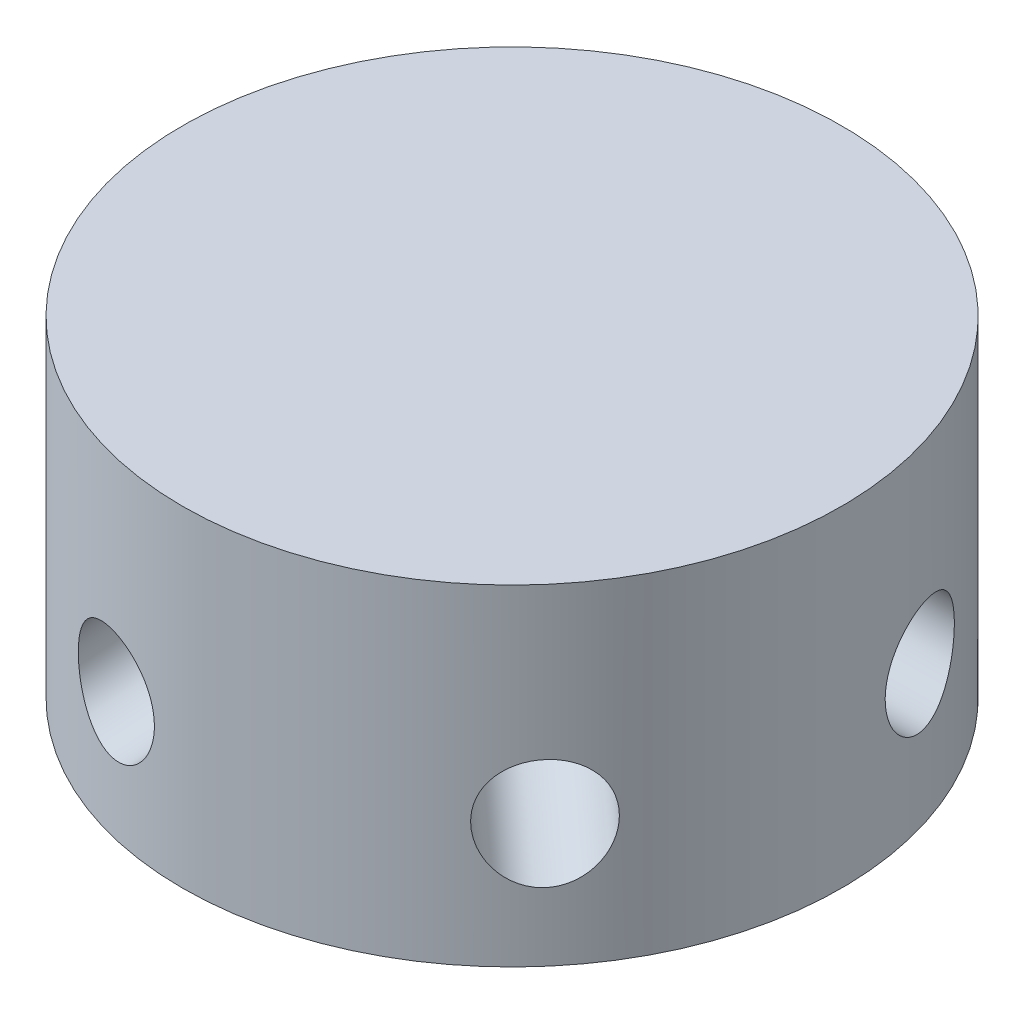
from build123d import *

# Parameters (mm, degrees)
BASE_DEPTH          = 3.035432218
BASE_DEPTH_BACK     = 7
SKETCH1_R           = 10
SKETCH3_R           = 1.6
HOLE2_DEPTH         = 19.445737436
HOLE2MIRROR_COUNT   = 2
SKETCH4_R           = 1.6
HOLE3_DEPTH         = 19.389503466
SKETCH5_R           = 1.6
CUT_EXTRUDE1_DEPTH  = 19.60459576
SKETCH6_R           = 1.6
CUT_EXTRUDE2_DEPTH  = 19.841947755
SKETCH7_R           = 1.6
CUT_EXTRUDE3_DEPTH  = 19.934353442
SKETCH8_R           = 5
BOSS_EXTRUDE1_DEPTH = 2


with BuildPart() as part:
    # Sketch1 → base (new, two sides: drawn at the far end of the back side and taken through both)
    with BuildSketch(Plane(origin=(0, 0, 0), x_dir=(1, 0, 0), z_dir=(0, 1, 0)).offset(-BASE_DEPTH_BACK)):
        Circle(SKETCH1_R)
    extrude(amount=BASE_DEPTH + BASE_DEPTH_BACK)

    # Sketch3 → hole2 (cut, through all)
    with BuildSketch(Plane(origin=(-0.941672921, -1.236067977, 3.685836142), x_dir=(-0.9718935871364875, 0.07382318789513377, -0.22354639834264944), z_dir=(0.23541823021467095, 0.3090169943749464, -0.921459035481267))):
        Circle(SKETCH3_R)
    hole2 = extrude(amount=-HOLE2_DEPTH, mode=Mode.SUBTRACT)

    # hole2mirror: hole2 ×2 about axis
    hole2mirror_axis = Axis((0, 5.5, 0), (0, -1, 0))
    for i in range(1, HOLE2MIRROR_COUNT):
        add(hole2.rotate(hole2mirror_axis, i * 360 / HOLE2MIRROR_COUNT), mode=Mode.SUBTRACT)

    # Sketch4 → hole3 (cut, through all)
    with BuildSketch(Plane(origin=(-3.717841, -1.236067977, 0.806098168), x_dir=(-0.19123247894507908, -0.06357892752956036, -0.979483465389136), z_dir=(0.9294602499075393, 0.30901699437494623, -0.20152454200243008))):
        Circle(SKETCH4_R)
    extrude(amount=-HOLE3_DEPTH, mode=Mode.SUBTRACT)

    # Sketch5 → Cut-Extrude1 (cut, through all)
    with BuildSketch(Plane(origin=(3.671965021, -1.093066116, -1.149730122), x_dir=(0.2754858058396647, -0.08200628219437099, 0.9578008876909271), z_dir=(-0.9179912552075574, 0.27326652891267317, 0.2874325304110031))):
        Circle(SKETCH5_R)
    extrude(amount=-CUT_EXTRUDE1_DEPTH, mode=Mode.SUBTRACT)

    # Sketch6 → Cut-Extrude2 (cut, through all)
    with BuildSketch(Plane(origin=(2.875583134, -1.236067977, 2.490613899), x_dir=(-0.5720437997755544, 0.24589274231852376, 0.782497699941298), z_dir=(-0.7188957835464718, 0.30901699437494723, -0.6226534747245682))):
        Circle(SKETCH6_R)
    extrude(amount=-CUT_EXTRUDE2_DEPTH, mode=Mode.SUBTRACT)

    # Sketch7 → Cut-Extrude3 (cut, through all)
    with BuildSketch(Plane(origin=(-2.670502563, -1.093066116, -2.770130417), x_dir=(0.7444971483747472, -0.2450509606833859, -0.6210265877802813), z_dir=(0.6676256406564008, 0.2732665289126714, 0.6925326043690294))):
        Circle(SKETCH7_R)
    extrude(amount=-CUT_EXTRUDE3_DEPTH, mode=Mode.SUBTRACT)

    # Sketch8 → Boss-Extrude1 (add)
    with BuildSketch(Plane.XZ.offset(7)):
        Circle(SKETCH8_R)
    extrude(amount=BOSS_EXTRUDE1_DEPTH)


solid = part.part
